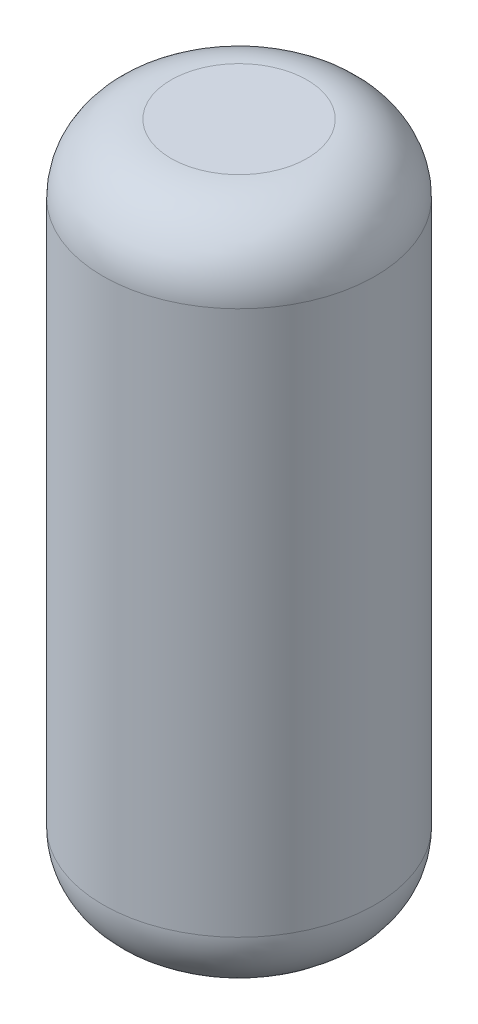
from build123d import *

# Parameters (mm, degrees)
ESQUISSE1_R        = 2
BOSS_EXTRU_1_DEPTH = 10
CONG_1_R           = 1


with BuildPart() as part:
    # Esquisse1 → Boss.-Extru.1 (new body)
    with BuildSketch(Plane(origin=(0, 0, 0), x_dir=(1, 0, 0), z_dir=(0, 1, 0))):
        Circle(ESQUISSE1_R)
    extrude(amount=BOSS_EXTRU_1_DEPTH)

    # Congé1
    cong_1_edges = [part.edges().sort_by_distance(p)[0] for p in [
        (-2, 10, 0),
        (-2, 0, 0),
    ]]
    fillet(cong_1_edges, radius=CONG_1_R)


solid = part.part
